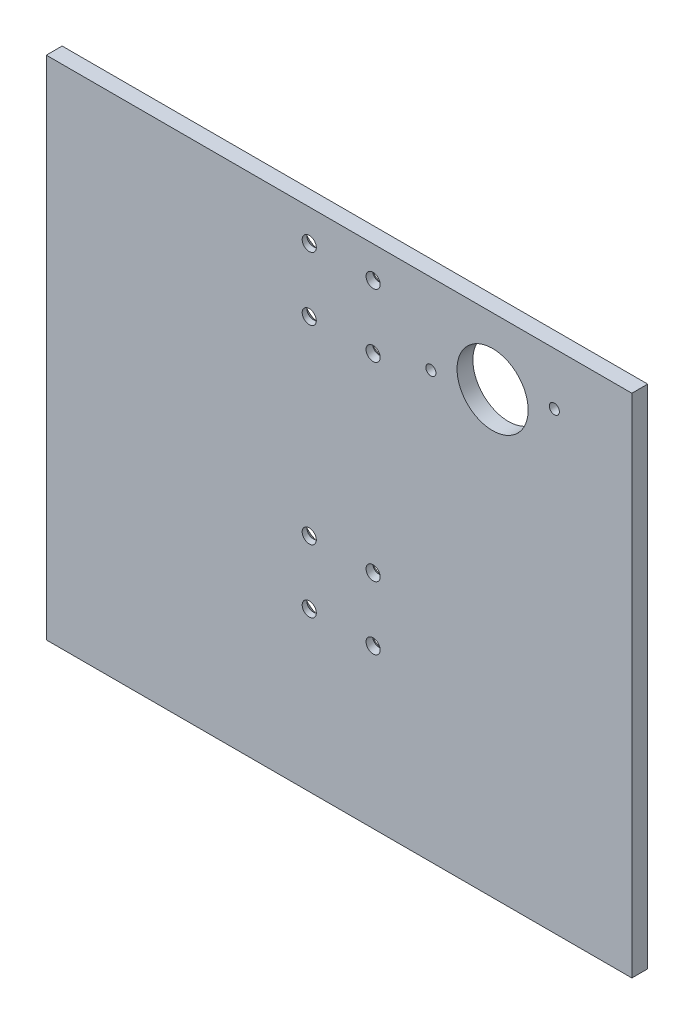
from build123d import *

# Parameters (mm, degrees)
SKETCH1_W                                          = 234.95
SKETCH1_H                                          = 203.2
BOSS_EXTRUDE1_DEPTH                                = 6.35
SKETCH2_R                                          = 14.2748
CUT_EXTRUDE1_DEPTH                                 = 156.445354144
CSK_FOR_10_FLAT_HEAD_MACHINE_SCREW_100_D           = 5.6134
CSK_FOR_10_FLAT_HEAD_MACHINE_SCREW_100_CSINK_D     = 17.78
CSK_FOR_10_FLAT_HEAD_MACHINE_SCREW_100_CSINK_ANGLE = 90
CSK_FOR_10_FLAT_HEAD_MACHINE_SCREW_2_D             = 5.6134
CSK_FOR_10_FLAT_HEAD_MACHINE_SCREW_2_CSINK_D       = 17.78
CSK_FOR_10_FLAT_HEAD_MACHINE_SCREW_2_CSINK_ANGLE   = 90
CUT_EXTRUDE2_DEPTH                                 = 156.445354144


with BuildPart() as part:
    # Sketch1 → Boss-Extrude1 (new body)
    with BuildSketch(Plane.XY):
        Rectangle(SKETCH1_W, SKETCH1_H)
    extrude(amount=BOSS_EXTRUDE1_DEPTH)

    # Sketch2 → Cut-Extrude1 (cut, through all)
    with BuildSketch(Plane.XY.offset(6.35)):
        with Locations((61.595, 74.93)):
            Circle(SKETCH2_R)
    extrude(amount=-CUT_EXTRUDE1_DEPTH, mode=Mode.SUBTRACT)

    # CSK for _10 Flat Head Machine Screw _100 (through all)
    with Locations(Plane(origin=(292.076985897, -265.595089466, -43.80037576), x_dir=(0.9908610866457157, 0, -0.1348862742137668), z_dir=(-0.1348862742137668, 0, -0.9908610866457157))):
        with Locations((-308.041854919, -227.495089466), (-308.041854919, -252.895089466), (-308.041972913, -329.095089466), (-308.041972913, -354.495089466)):
            CounterSinkHole(CSK_FOR_10_FLAT_HEAD_MACHINE_SCREW_100_D / 2, CSK_FOR_10_FLAT_HEAD_MACHINE_SCREW_100_CSINK_D / 2, counter_sink_angle=CSK_FOR_10_FLAT_HEAD_MACHINE_SCREW_100_CSINK_ANGLE)

    # CSK for _10 Flat Head Machine Screw  2 (through all)
    with Locations(Plane(origin=(292.419597033, -265.595089466, -41.283588599), x_dir=(0.9908610866457157, 0, -0.13488627421376656), z_dir=(-0.13488627421376656, 0, -0.9908610866457157))):
        with Locations((-282.641854919, -227.495089466), (-282.641854919, -252.895089466), (-282.641972913, -329.095089466), (-282.641972913, -354.495089466)):
            CounterSinkHole(CSK_FOR_10_FLAT_HEAD_MACHINE_SCREW_2_D / 2, CSK_FOR_10_FLAT_HEAD_MACHINE_SCREW_2_CSINK_D / 2, counter_sink_angle=CSK_FOR_10_FLAT_HEAD_MACHINE_SCREW_2_CSINK_ANGLE)

    # Sketch10 → Cut-Extrude2 (cut, through all)
    with BuildSketch(Plane(origin=(0, 0, 0), x_dir=(-1, 0, 0), z_dir=(0, 0, -1))):
        with BuildLine():
            ThreePointArc((-85.905304985, 82.561948902), (-88.324015931, 81.043732073), (-86.805799102, 78.625021127))
            ThreePointArc((-86.805799102, 78.625021127), (-84.387088156, 80.143237956), (-85.905304985, 82.561948902))
        make_face()
        with BuildLine():
            ThreePointArc((-36.384200898, 71.234978873), (-38.802911844, 69.716762044), (-37.284695016, 67.298051098))
            ThreePointArc((-37.284695016, 67.298051098), (-34.86598407, 68.816267927), (-36.384200898, 71.234978873))
        make_face()
    extrude(amount=-CUT_EXTRUDE2_DEPTH, mode=Mode.SUBTRACT)


solid = part.part
